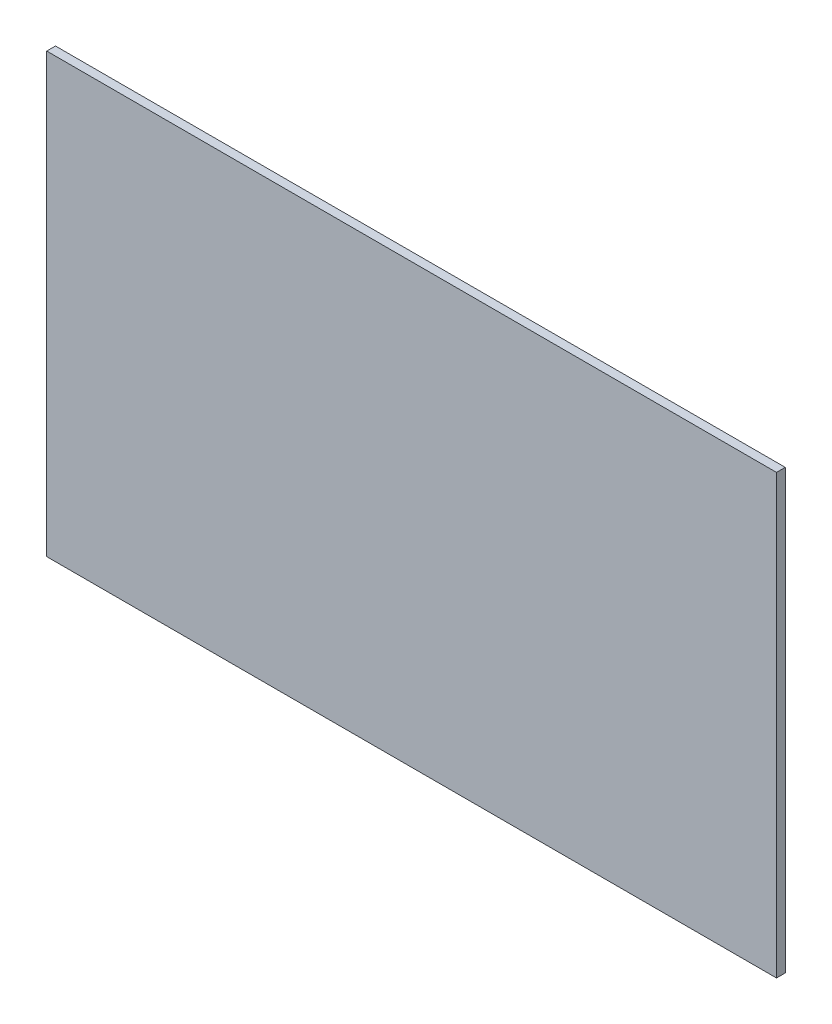
from build123d import *

# Parameters (mm, degrees)
SKETCH1_W           = 250
SKETCH1_H           = 150
BOSS_EXTRUDE1_DEPTH = 3


with BuildPart() as part:
    # Sketch1 → Boss-Extrude1 (new body)
    with BuildSketch(Plane.XY):
        Rectangle(SKETCH1_W, SKETCH1_H)
    extrude(amount=BOSS_EXTRUDE1_DEPTH)


solid = part.part
